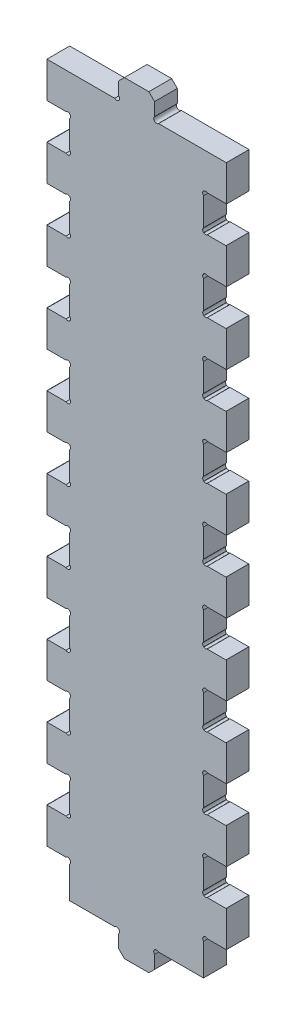
from build123d import *

# Parameters (mm, degrees)
BOSS_EXTRUDE1_DEPTH = 6.35
CHAMFER1_SIZE       = 1.5875
SKETCH1_W           = 6.31593513
SKETCH1_H           = 10.068268446
SKETCH1_W_2         = 6.289133039
SKETCH1_H_2         = 10.1524
CUT_EXTRUDE1_DEPTH  = 212.011770999
LPATTERN1_COUNT     = 9
LPATTERN1_PITCH     = 20
SKETCH3_W           = 2.992753623
SKETCH3_H           = 0.405797101
CUT_EXTRUDE3_DEPTH  = 2.54


# Read off the part's stored shape, not the designer's step: Boss-Extrude1
with BuildPart() as part:
    # Boss-Extrude1 outline → Boss-Extrude1 (new body)
    with BuildSketch(Plane.XY):
        with BuildLine():
            Line((-6.35, 190), (-1.066002504, 190))
            ThreePointArc((-1.066002504, 190), (0.02634773, 189.921017806), (0, 188.826132873))
            Line((0, 188.826132873), (0, 181.122532015))
            ThreePointArc((0, 181.122532015), (0, 180), (-1.122532015, 180))
            Line((-1.122532015, 180), (-6.35, 180))
            Line((-6.35, 180), (-6.35, 170))
            Line((-6.35, 170), (-1.122532015, 170))
            ThreePointArc((-1.122532015, 170), (0, 170), (0, 168.877467985))
            Line((0, 168.877467985), (0, 161.122532015))
            ThreePointArc((0, 161.122532015), (0, 160), (-1.122532015, 160))
            Line((-1.122532015, 160), (-6.35, 160))
            Line((-6.35, 160), (-6.35, 150))
            Line((-6.35, 150), (-1.122532015, 150))
            ThreePointArc((-1.122532015, 150), (0, 150), (0, 148.877467985))
            Line((0, 148.877467985), (0, 141.122532015))
            ThreePointArc((0, 141.122532015), (0, 140), (-1.122532015, 140))
            Line((-1.122532015, 140), (-6.35, 140))
            Line((-6.35, 140), (-6.35, 130))
            Line((-6.35, 130), (-1.122532015, 130))
            ThreePointArc((-1.122532015, 130), (0, 130), (0, 128.877467985))
            Line((0, 128.877467985), (0, 121.122532015))
            ThreePointArc((0, 121.122532015), (0, 120), (-1.122532015, 120))
            Line((-1.122532015, 120), (-6.35, 120))
            Line((-6.35, 120), (-6.35, 110))
            Line((-6.35, 110), (-1.122532015, 110))
            ThreePointArc((-1.122532015, 110), (0, 110), (0, 108.877467985))
            Line((0, 108.877467985), (0, 101.122532015))
            ThreePointArc((0, 101.122532015), (0, 100), (-1.122532015, 100))
            Line((-1.122532015, 100), (-6.35, 100))
            Line((-6.35, 100), (-6.35, 90))
            Line((-6.35, 90), (-1.122532015, 90))
            ThreePointArc((-1.122532015, 90), (0, 90), (0, 88.877467985))
            Line((0, 88.877467985), (0, 81.122532015))
            ThreePointArc((0, 81.122532015), (0, 80), (-1.122532015, 80))
            Line((-1.122532015, 80), (-6.35, 80))
            Line((-6.35, 80), (-6.35, 70))
            Line((-6.35, 70), (-1.122532015, 70))
            ThreePointArc((-1.122532015, 70), (0, 70), (0, 68.877467985))
            Line((0, 68.877467985), (0, 61.122532015))
            ThreePointArc((0, 61.122532015), (0, 60), (-1.122532015, 60))
            Line((-1.122532015, 60), (-6.35, 60))
            Line((-6.35, 60), (-6.35, 50))
            Line((-6.35, 50), (-1.122532015, 50))
            ThreePointArc((-1.122532015, 50), (0, 50), (0, 48.877467985))
            Line((0, 48.877467985), (0, 41.122532015))
            ThreePointArc((0, 41.122532015), (0, 40), (-1.122532015, 40))
            Line((-1.122532015, 40), (-6.35, 40))
            Line((-6.35, 40), (-6.35, 30))
            Line((-6.35, 30), (-1.122532015, 30))
            ThreePointArc((-1.122532015, 30), (0, 30), (0, 28.877467985))
            Line((0, 28.877467985), (0, 21.122532015))
            ThreePointArc((0, 21.122532015), (0, 20), (-1.122532015, 20))
            Line((-1.122532015, 20), (-6.35, 20))
            Line((-6.35, 20), (-6.35, 10))
            Line((-6.35, 10), (-1.122532015, 10))
            ThreePointArc((-1.122532015, 10), (0, 10), (0, 8.877467985))
            Line((0, 8.877467985), (0, 0))
            Line((0, 0), (12.527467985, 0))
            ThreePointArc((12.527467985, 0), (13.65, 0), (13.65, -1.122532015))
            Line((13.65, -1.122532015), (13.65, -6.35))
            Line((13.65, -6.35), (23.65, -6.35))
            Line((23.65, -6.35), (23.65, -1.122532015))
            ThreePointArc((23.65, -1.122532015), (23.65, 0), (24.772532015, 0))
            Line((24.772532015, 0), (37.3, 0))
            Line((37.3, 0), (37.3, 8.877467985))
            ThreePointArc((37.3, 8.877467985), (37.3, 10), (38.422532015, 10))
            Line((38.422532015, 10), (43.65, 10))
            Line((43.65, 10), (43.65, 20))
            Line((43.65, 20), (38.422532015, 20))
            ThreePointArc((38.422532015, 20), (37.3, 20), (37.3, 21.122532015))
            Line((37.3, 21.122532015), (37.3, 28.877467985))
            ThreePointArc((37.3, 28.877467985), (37.3, 30), (38.422532015, 30))
            Line((38.422532015, 30), (43.65, 30))
            Line((43.65, 30), (43.65, 40))
            Line((43.65, 40), (38.422532015, 40))
            ThreePointArc((38.422532015, 40), (37.3, 40), (37.3, 41.122532015))
            Line((37.3, 41.122532015), (37.3, 48.877467985))
            ThreePointArc((37.3, 48.877467985), (37.3, 50), (38.422532015, 50))
            Line((38.422532015, 50), (43.65, 50))
            Line((43.65, 50), (43.65, 60))
            Line((43.65, 60), (38.422532015, 60))
            ThreePointArc((38.422532015, 60), (37.3, 60), (37.3, 61.122532015))
            Line((37.3, 61.122532015), (37.3, 68.877467985))
            ThreePointArc((37.3, 68.877467985), (37.3, 70), (38.422532015, 70))
            Line((38.422532015, 70), (43.65, 70))
            Line((43.65, 70), (43.65, 80))
            Line((43.65, 80), (38.422532015, 80))
            ThreePointArc((38.422532015, 80), (37.3, 80), (37.3, 81.122532015))
            Line((37.3, 81.122532015), (37.3, 88.877467985))
            ThreePointArc((37.3, 88.877467985), (37.3, 90), (38.422532015, 90))
            Line((38.422532015, 90), (43.65, 90))
            Line((43.65, 90), (43.65, 100))
            Line((43.65, 100), (38.422532015, 100))
            ThreePointArc((38.422532015, 100), (37.3, 100), (37.3, 101.122532015))
            Line((37.3, 101.122532015), (37.3, 108.877467985))
            ThreePointArc((37.3, 108.877467985), (37.3, 110), (38.422532015, 110))
            Line((38.422532015, 110), (43.65, 110))
            Line((43.65, 110), (43.65, 120))
            Line((43.65, 120), (38.422532015, 120))
            ThreePointArc((38.422532015, 120), (37.3, 120), (37.3, 121.122532015))
            Line((37.3, 121.122532015), (37.3, 128.877467985))
            ThreePointArc((37.3, 128.877467985), (37.3, 130), (38.422532015, 130))
            Line((38.422532015, 130), (43.65, 130))
            Line((43.65, 130), (43.65, 140))
            Line((43.65, 140), (38.422532015, 140))
            ThreePointArc((38.422532015, 140), (37.3, 140), (37.3, 141.122532015))
            Line((37.3, 141.122532015), (37.3, 148.877467985))
            ThreePointArc((37.3, 148.877467985), (37.3, 150), (38.422532015, 150))
            Line((38.422532015, 150), (43.65, 150))
            Line((43.65, 150), (43.65, 160))
            Line((43.65, 160), (38.422532015, 160))
            ThreePointArc((38.422532015, 160), (37.3, 160), (37.3, 161.122532015))
            Line((37.3, 161.122532015), (37.3, 168.877467985))
            ThreePointArc((37.3, 168.877467985), (37.3, 170), (38.422532015, 170))
            Line((38.422532015, 170), (43.65, 170))
            Line((43.65, 170), (43.65, 180))
            Line((43.65, 180), (38.422532015, 180))
            ThreePointArc((38.422532015, 180), (37.3, 180), (37.3, 181.122532015))
            Line((37.3, 181.122532015), (37.3, 188.877467985))
            ThreePointArc((37.3, 188.877467985), (37.3, 190), (38.422532015, 190))
            Line((38.422532015, 190), (43.65, 190))
            Line((43.65, 190), (43.65, 200))
            Line((43.65, 200), (24.772532015, 200))
            ThreePointArc((24.772532015, 200), (23.65, 200), (23.65, 201.122532015))
            Line((23.65, 201.122532015), (23.65, 206.35))
            Line((23.65, 206.35), (13.65, 206.35))
            Line((13.65, 206.35), (13.65, 201.122532015))
            ThreePointArc((13.65, 201.122532015), (13.65, 200), (12.527467985, 200))
            Line((12.527467985, 200), (-6.35, 200))
            Line((-6.35, 200), (-6.35, 190))
        make_face()
    extrude(amount=BOSS_EXTRUDE1_DEPTH)

    # Chamfer1
    chamfer1_edges = [part.edges().sort_by_distance(p)[0] for p in [
        (13.65, 206.35, 3.175),
        (23.65, 206.35, 3.175),
        (23.65, -6.35, 3.175),
        (13.65, -6.35, 3.175),
    ]]
    chamfer(chamfer1_edges, length=CHAMFER1_SIZE)

    # Sketch1 → Cut-Extrude1 (cut, through all)
    with BuildSketch(Plane.XY.offset(6.35)):
        with Locations((-3.175002191, 184.974332444)):
            Rectangle(SKETCH1_W, SKETCH1_H)
        with Locations((40.474994567, 185)):
            Rectangle(SKETCH1_W_2, SKETCH1_H_2)
    cut_extrude1 = extrude(amount=-CUT_EXTRUDE1_DEPTH, mode=Mode.SUBTRACT)

    # LPattern1: Cut-Extrude1 ×9
    with Locations(*[(0, -i * LPATTERN1_PITCH, 0) for i in range(1, LPATTERN1_COUNT)]):
        add(cut_extrude1, mode=Mode.SUBTRACT)

    # Sketch3 → Cut-Extrude3 (cut)
    # profile 1 of 8: a face of its own
    with BuildSketch(Plane(origin=(0, 0, 0), x_dir=(-1, 0, 0), z_dir=(0, 0, -1))):
        with BuildLine():
            add(Edge.make_bspline(
                [(-31.669565217, 1.371449275), (-31.739195333, 1.347927689), (-31.878102831, 1.301003673), (-32.094061516, 1.254258906), (-32.314414682, 1.224655982), (-32.463362925, 1.221075114), (-32.538224638, 1.219275362)],
                knots=[0, 0, 0, 0, 0.994474773, 1.983911717, 2.986709619, 4, 4, 4, 4], degree=3))
            add(Edge.make_bspline(
                [(-32.538224638, 1.219275362), (-32.597461378, 1.220651993), (-32.712873714, 1.223334114), (-32.880657539, 1.243924608), (-33.037760981, 1.278845672), (-33.184646189, 1.327029017), (-33.321063485, 1.389662833), (-33.44631955, 1.467338836), (-33.561208509, 1.558024136), (-33.665039887, 1.662813822), (-33.757386997, 1.781315104), (-33.836435826, 1.914017245), (-33.904619253, 2.05928729), (-33.958155229, 2.218629134), (-34.002573318, 2.39033234), (-34.031435227, 2.575634592), (-34.050187662, 2.773914739), (-34.052453103, 2.910578207), (-34.053623188, 2.981163949)],
                knots=[0, 0, 0, 0, 1.072370344, 2.089324368, 3.054894172, 3.982167072, 4.883220536, 5.766007853, 6.644560033, 7.52738623, 8.430658994, 9.357672753, 10.318538922, 11.330575956, 12.396783324, 13.526066154, 14.722230158, 16, 16, 16, 16], degree=3))
            add(Edge.make_bspline(
                [(-34.053623188, 2.981163949), (-34.052146608, 3.049894194), (-34.049255307, 3.184475335), (-34.029807187, 3.381226133), (-33.995207247, 3.56759635), (-33.949398299, 3.743773361), (-33.888708922, 3.907882056), (-33.817665032, 4.0603251), (-33.7342573, 4.199499651), (-33.63966111, 4.325672029), (-33.533369297, 4.438144093), (-33.416752828, 4.537759358), (-33.288803984, 4.622896086), (-33.151359522, 4.694576142), (-33.003836974, 4.751221896), (-32.847411307, 4.790992406), (-32.682528536, 4.816729312), (-32.569762619, 4.819372394), (-32.512069746, 4.820724638)],
                knots=[0, 0, 0, 0, 1.219579151, 2.388065895, 3.50339749, 4.580233523, 5.613961845, 6.603771101, 7.560489467, 8.487754287, 9.396405489, 10.300984393, 11.203313264, 12.1174982, 13.046432371, 14.000390303, 14.976967236, 16, 16, 16, 16], degree=3))
            add(Edge.make_bspline(
                [(-32.512069746, 4.820724638), (-32.472691142, 4.820309343), (-32.395188832, 4.819491989), (-32.281277856, 4.811830577), (-32.171631973, 4.801507882), (-32.03228403, 4.77870042), (-31.863035382, 4.740545133), (-31.733837361, 4.692467772), (-31.669565217, 4.668550725)],
                knots=[0, 0, 0, 0, 0.82263702, 1.61905864, 2.384719601, 3.122514214, 4.568537041, 6, 6, 6, 6], degree=3))
            Line((-31.669565217, 4.668550725), (-31.669565217, 4.212028986))
            add(Edge.make_bspline(
                [(-31.669565217, 4.212028986), (-31.700818043, 4.228006992), (-31.762750675, 4.259670049), (-31.858927014, 4.300256406), (-31.956563093, 4.334988724), (-32.056642321, 4.363716119), (-32.15924419, 4.38692655), (-32.266166522, 4.40374771), (-32.377690026, 4.413104658), (-32.453666685, 4.414313541), (-32.492255435, 4.414927536)],
                knots=[0, 0, 0, 0, 0.983614603, 1.949194672, 2.923566415, 3.886871985, 4.866016098, 5.870457402, 6.918399582, 8, 8, 8, 8], degree=3))
            add(Edge.make_bspline(
                [(-32.492255435, 4.414927536), (-32.53170594, 4.414079098), (-32.608940542, 4.412418059), (-32.72173213, 4.392935509), (-32.829173737, 4.364356351), (-32.930335592, 4.322530852), (-33.025212266, 4.270502436), (-33.112065741, 4.205955487), (-33.192562939, 4.132297811), (-33.264988403, 4.047542217), (-33.329231223, 3.952734893), (-33.385538918, 3.847928391), (-33.435033831, 3.733595378), (-33.474634002, 3.608856667), (-33.507644287, 3.475288013), (-33.530095036, 3.3323738), (-33.543649929, 3.180363856), (-33.545450622, 3.076037954), (-33.546376812, 3.022377717)],
                knots=[0, 0, 0, 0, 0.961408976, 1.882207611, 2.784411545, 3.668921893, 4.545980223, 5.417431557, 6.302341026, 7.202770486, 8.13058038, 9.09095177, 10.101446619, 11.165409356, 12.279999165, 13.455113719, 14.691032636, 16, 16, 16, 16], degree=3))
            add(Edge.make_bspline(
                [(-33.546376812, 3.022377717), (-33.545723125, 2.966344917), (-33.544457099, 2.857823606), (-33.531687922, 2.700300155), (-33.510331954, 2.553410374), (-33.481592801, 2.416771879), (-33.443561706, 2.290738296), (-33.396906293, 2.175558302), (-33.342149559, 2.07061959), (-33.278590361, 1.976776906), (-33.206998732, 1.893174316), (-33.126079069, 1.821964093), (-33.038602635, 1.759558623), (-32.941622641, 1.711121664), (-32.838070087, 1.671337078), (-32.726027286, 1.645283692), (-32.606664741, 1.627932746), (-32.524288663, 1.626043454), (-32.481951993, 1.625072464)],
                knots=[0, 0, 0, 0, 1.34450783, 2.603970389, 3.789343747, 4.904814261, 5.951782154, 6.944310538, 7.883053746, 8.786934864, 9.658944679, 10.516661903, 11.367981323, 12.229999549, 13.110838734, 14.024275634, 14.984588823, 16, 16, 16, 16], degree=3))
            add(Edge.make_bspline(
                [(-32.481951993, 1.625072464), (-32.44546661, 1.625597048), (-32.373138953, 1.62663697), (-32.265962825, 1.637522956), (-32.161109069, 1.653958868), (-32.024587415, 1.684880566), (-31.858072178, 1.737895316), (-31.732355894, 1.797967273), (-31.669565217, 1.827971014)],
                knots=[0, 0, 0, 0, 0.776705674, 1.539720753, 2.291683871, 3.035542813, 4.519362263, 6, 6, 6, 6], degree=3))
            Line((-31.669565217, 1.827971014), (-31.669565217, 1.371449275))
        make_face()
    # profile 2 of 8: a face of its own
    with BuildSketch(Plane(origin=(0, 0, 0), x_dir=(-1, 0, 0), z_dir=(0, 0, -1))):
        with BuildLine():
            add(Edge.make_bspline(
                [(-28.473913043, 3.042984601), (-28.475228447, 2.966845569), (-28.477768509, 2.819820029), (-28.498691345, 2.60738994), (-28.531869502, 2.410756522), (-28.58027643, 2.230228254), (-28.641039128, 2.065841825), (-28.709614146, 1.915433039), (-28.788950258, 1.780200367), (-28.877820501, 1.659642575), (-28.976030807, 1.554801835), (-29.081000327, 1.462639641), (-29.196205585, 1.387760737), (-29.31749743, 1.325488378), (-29.444853826, 1.278198208), (-29.575949064, 1.243802001), (-29.710765698, 1.223740262), (-29.801671738, 1.220770552), (-29.847441123, 1.219275362)],
                knots=[0, 0, 0, 0, 1.423082774, 2.747992794, 3.986236128, 5.147128242, 6.236197569, 7.259302453, 8.233395673, 9.161912359, 10.053001658, 10.914402565, 11.766421957, 12.614596425, 13.458547256, 14.300675266, 15.144423756, 16, 16, 16, 16], degree=3))
            add(Edge.make_bspline(
                [(-29.847441123, 1.219275362), (-29.901424707, 1.220748877), (-30.006208407, 1.223609012), (-30.157998749, 1.247107372), (-30.299147587, 1.284739236), (-30.429785903, 1.33814703), (-30.548892308, 1.406847955), (-30.658231986, 1.488313215), (-30.756067663, 1.584380358), (-30.843558352, 1.693479173), (-30.920021031, 1.81601454), (-30.985425388, 1.951217929), (-31.041029109, 2.098721403), (-31.085818589, 2.258431097), (-31.120414745, 2.429607172), (-31.144383481, 2.611545929), (-31.159998336, 2.803618457), (-31.161532676, 2.935162748), (-31.162318841, 3.002563406)],
                knots=[0, 0, 0, 0, 1.030115455, 1.999483942, 2.924432069, 3.813267415, 4.685316872, 5.542716903, 6.40939724, 7.295524004, 8.206506083, 9.160640047, 10.158252241, 11.211975818, 12.323750963, 13.4892538, 14.713543989, 16, 16, 16, 16], degree=3))
            add(Edge.make_bspline(
                [(-31.162318841, 3.002563406), (-31.160896447, 3.077899952), (-31.158146266, 3.223562242), (-31.138583131, 3.434517882), (-31.104931941, 3.629935553), (-31.057372036, 3.809929), (-30.997799031, 3.974363234), (-30.928734876, 4.124261547), (-30.8508524, 4.25996585), (-30.761250926, 4.3795857), (-30.663177066, 4.484740581), (-30.558096251, 4.576639822), (-30.443922204, 4.652475143), (-30.323287376, 4.714661318), (-30.196353547, 4.761635893), (-30.065598845, 4.796318613), (-29.931008715, 4.816238608), (-29.840106319, 4.819222372), (-29.794338768, 4.820724638)],
                knots=[0, 0, 0, 0, 1.41309666, 2.732205102, 3.969807196, 5.128608405, 6.219709524, 7.24631839, 8.221244419, 9.148965463, 10.043106611, 10.914447659, 11.761129373, 12.607796584, 13.454637821, 14.294855332, 15.141493535, 16, 16, 16, 16], degree=3))
            add(Edge.make_bspline(
                [(-29.794338768, 4.820724638), (-29.740364217, 4.819205794), (-29.635336796, 4.816250322), (-29.483350255, 4.793314891), (-29.342341779, 4.754302026), (-29.212179065, 4.700137448), (-29.092477706, 4.631499895), (-28.983369883, 4.549457627), (-28.884588873, 4.454102795), (-28.797712351, 4.344814066), (-28.720310859, 4.223092958), (-28.652807456, 4.089223539), (-28.59787567, 3.94189839), (-28.551864665, 3.78323559), (-28.516761185, 3.613040237), (-28.49153954, 3.432233125), (-28.476310925, 3.241127673), (-28.474725472, 3.110117664), (-28.473913043, 3.042984601)],
                knots=[0, 0, 0, 0, 1.031800753, 2.007749398, 2.930678117, 3.822900438, 4.696376593, 5.562252438, 6.426830471, 7.314406963, 8.225311853, 9.18096675, 10.175487812, 11.227471919, 12.337140194, 13.495232744, 14.716489688, 16, 16, 16, 16], degree=3))
        make_face()
        with BuildLine():
            add(Edge.make_bspline(
                [(-28.98115942, 3.008903986), (-28.981926533, 3.059632923), (-28.983429722, 3.159038275), (-28.990533411, 3.304869863), (-29.00641256, 3.443823063), (-29.025438421, 3.575988389), (-29.05118557, 3.700613221), (-29.084697001, 3.816507216), (-29.123633609, 3.924148555), (-29.171405434, 4.022056517), (-29.226090432, 4.110228152), (-29.287252674, 4.189423441), (-29.357349177, 4.256635198), (-29.434252079, 4.31396847), (-29.518946842, 4.359667179), (-29.6121679, 4.392455719), (-29.713776225, 4.411515246), (-29.784217551, 4.413767608), (-29.820493659, 4.414927536)],
                knots=[0, 0, 0, 0, 1.323673599, 2.593790554, 3.807090586, 4.970987518, 6.076778004, 7.123914636, 8.116191169, 9.059475772, 9.960330598, 10.819370074, 11.662669578, 12.485668992, 13.315223066, 14.163241623, 15.054100047, 16, 16, 16, 16], degree=3))
            add(Edge.make_bspline(
                [(-29.820493659, 4.414927536), (-29.855710842, 4.413461751), (-29.924346334, 4.410605053), (-30.023927459, 4.391125777), (-30.115110247, 4.355548722), (-30.198466369, 4.307316432), (-30.274088053, 4.247558746), (-30.341549251, 4.176452065), (-30.403836351, 4.097424967), (-30.457817214, 4.007728909), (-30.503613603, 3.909137643), (-30.54591447, 3.803176701), (-30.578734751, 3.688170111), (-30.607775025, 3.566407128), (-30.62856039, 3.438398216), (-30.643297926, 3.306117388), (-30.653389461, 3.169950555), (-30.654505458, 3.077876258), (-30.655072464, 3.031096014)],
                knots=[0, 0, 0, 0, 0.938104053, 1.828290259, 2.688226573, 3.533173995, 4.38495139, 5.245952462, 6.138444459, 7.060521377, 8.026891732, 9.031849607, 10.096184638, 11.209149641, 12.36492099, 13.547735175, 14.754076334, 16, 16, 16, 16], degree=3))
            add(Edge.make_bspline(
                [(-30.655072464, 3.031096014), (-30.654449258, 2.979828752), (-30.653234042, 2.879860407), (-30.644176454, 2.733124897), (-30.630496216, 2.593393901), (-30.609919061, 2.460814719), (-30.583396469, 2.336556572), (-30.550078425, 2.221052236), (-30.510641972, 2.114287784), (-30.464308956, 2.016509345), (-30.409917181, 1.928699423), (-30.349292722, 1.849969745), (-30.279157788, 1.78352854), (-30.204110145, 1.72499193), (-30.11921056, 1.680375974), (-30.026952634, 1.647741059), (-29.92617417, 1.62840114), (-29.856509354, 1.626206869), (-29.820493659, 1.625072464)],
                knots=[0, 0, 0, 0, 1.340540585, 2.613980496, 3.843097936, 5.010722051, 6.120504555, 7.163418743, 8.151508278, 9.093960035, 9.987380757, 10.848401497, 11.683877306, 12.507385072, 13.329500698, 14.179475102, 15.05881515, 16, 16, 16, 16], degree=3))
            add(Edge.make_bspline(
                [(-29.820493659, 1.625072464), (-29.785245128, 1.626400933), (-29.716754028, 1.628982269), (-29.617896974, 1.650252809), (-29.526318043, 1.684356466), (-29.442558052, 1.732724667), (-29.366167488, 1.792430013), (-29.297821632, 1.863274866), (-29.235601592, 1.942784284), (-29.180978268, 2.032425908), (-29.132976638, 2.130425457), (-29.091684681, 2.236825819), (-29.056869344, 2.350719034), (-29.029787261, 2.472495751), (-29.00729818, 2.599899639), (-28.99299489, 2.732578643), (-28.982822061, 2.869253151), (-28.981719534, 2.961858103), (-28.98115942, 3.008903986)],
                knots=[0, 0, 0, 0, 0.936906737, 1.820494917, 2.676828052, 3.526792157, 4.383009914, 5.247809723, 6.13916262, 7.06372975, 8.034989121, 9.038664354, 10.096936984, 11.200050273, 12.355522744, 13.536827286, 14.74863997, 16, 16, 16, 16], degree=3))
        make_face(mode=Mode.SUBTRACT)
    # profile 3 of 8: a face of its own
    with BuildSketch(Plane(origin=(0, 0, 0), x_dir=(-1, 0, 0), z_dir=(0, 0, -1))):
        with BuildLine():
            Line((-25.531884058, 1.27), (-26.069248188, 1.27))
            Line((-26.069248188, 1.27), (-26.572531703, 2.362957428))
            add(Edge.make_bspline(
                [(-26.572531703, 2.362957428), (-26.59071745, 2.401706773), (-26.624454269, 2.473591622), (-26.683855152, 2.567982497), (-26.745377969, 2.644032892), (-26.812021148, 2.702499767), (-26.884726718, 2.745154031), (-26.963955282, 2.772750588), (-27.050856191, 2.788792395), (-27.111407774, 2.790724962), (-27.143183877, 2.79173913)],
                knots=[0, 0, 0, 0, 1.339134837, 2.484261414, 3.482991323, 4.391871607, 5.244507385, 6.105289549, 7.005698766, 8, 8, 8, 8], degree=3))
            Line((-27.143183877, 2.79173913), (-27.357971014, 2.79173913))
            Line((-27.357971014, 2.79173913), (-27.357971014, 1.27))
            Line((-27.357971014, 1.27), (-27.865217391, 1.27))
            Line((-27.865217391, 1.27), (-27.865217391, 4.77))
            Line((-27.865217391, 4.77), (-26.934737319, 4.77))
            add(Edge.make_bspline(
                [(-26.934737319, 4.77), (-26.88583097, 4.769366361), (-26.791538416, 4.768144689), (-26.65538895, 4.755266173), (-26.5298858, 4.734490516), (-26.415222463, 4.704095291), (-26.310621888, 4.666954567), (-26.215725616, 4.622570659), (-26.130520694, 4.571200811), (-26.05533264, 4.51258738), (-25.988863898, 4.44862251), (-25.9330839, 4.376973978), (-25.885783361, 4.299801302), (-25.848661682, 4.215927791), (-25.820514838, 4.127009504), (-25.7995048, 4.033467957), (-25.787775054, 3.935195092), (-25.786271456, 3.868082264), (-25.785507246, 3.83397192)],
                knots=[0, 0, 0, 0, 1.390037284, 2.680023546, 3.883960013, 5.002565466, 6.047913656, 7.03574216, 7.976084698, 8.870016629, 9.741095147, 10.591561451, 11.444313202, 12.308368875, 13.191986167, 14.092206828, 15.030357037, 16, 16, 16, 16], degree=3))
            add(Edge.make_bspline(
                [(-25.785507246, 3.83397192), (-25.78614064, 3.806470167), (-25.787386286, 3.752384571), (-25.796541935, 3.672416754), (-25.810405144, 3.594646937), (-25.831177465, 3.51943529), (-25.857372341, 3.447074993), (-25.889008124, 3.377623321), (-25.92739873, 3.311847098), (-25.970855036, 3.249061153), (-26.020300638, 3.190279445), (-26.074908756, 3.135303891), (-26.135985286, 3.085425286), (-26.201171245, 3.038559939), (-26.27224957, 2.997093549), (-26.348501973, 2.961662975), (-26.429540429, 2.931184091), (-26.485997266, 2.915973394), (-26.514673913, 2.908247283)],
                knots=[0, 0, 0, 0, 1.032708305, 2.030948508, 3.019625047, 3.996933367, 4.957424013, 5.907556856, 6.85893238, 7.814077788, 8.77200233, 9.740252168, 10.719774328, 11.730219428, 12.753012585, 13.805036997, 14.885091985, 16, 16, 16, 16], degree=3))
            add(Edge.make_bspline(
                [(-26.514673913, 2.908247283), (-26.491365725, 2.899698355), (-26.445120721, 2.88273671), (-26.381537422, 2.844964981), (-26.321734957, 2.801060751), (-26.26943634, 2.744951285), (-26.218302198, 2.681752522), (-26.167615772, 2.608930821), (-26.116144477, 2.526752178), (-26.083731693, 2.467493302), (-26.066870471, 2.436666667)],
                knots=[0, 0, 0, 0, 0.890820497, 1.767447404, 2.649001527, 3.549193506, 4.515009134, 5.571837998, 6.736863216, 8, 8, 8, 8], degree=3))
            Line((-26.066870471, 2.436666667), (-25.531884058, 1.27))
        make_face()
        with BuildLine():
            add(Edge.make_bspline(
                [(-26.292753623, 3.799891304), (-26.293124706, 3.822898772), (-26.293843697, 3.867476789), (-26.301801751, 3.932004947), (-26.315419329, 3.991916103), (-26.333559167, 4.04743245), (-26.356222969, 4.099077043), (-26.386280569, 4.145069931), (-26.420207314, 4.187386547), (-26.459395879, 4.224918851), (-26.503530008, 4.257569148), (-26.552021493, 4.285946413), (-26.604420772, 4.310685313), (-26.661240636, 4.330650541), (-26.722407824, 4.345246859), (-26.787751823, 4.356626993), (-26.857479949, 4.36267721), (-26.905401996, 4.363685654), (-26.929981884, 4.364202899)],
                knots=[0, 0, 0, 0, 1.136086502, 2.201219443, 3.204852043, 4.166451082, 5.083443327, 5.98129036, 6.87199526, 7.758098985, 8.653381414, 9.577773354, 10.529401831, 11.511765708, 12.546811162, 13.632454437, 14.78565276, 16, 16, 16, 16], degree=3))
            Line((-26.929981884, 4.364202899), (-27.357971014, 4.364202899))
            Line((-27.357971014, 4.364202899), (-27.357971014, 3.197536232))
            Line((-27.357971014, 3.197536232), (-26.991009964, 3.197536232))
            add(Edge.make_bspline(
                [(-26.991009964, 3.197536232), (-26.964844251, 3.198003869), (-26.913732163, 3.198917352), (-26.839172344, 3.205692333), (-26.768930469, 3.219058388), (-26.702309597, 3.234864927), (-26.640278984, 3.257282772), (-26.583156087, 3.284404318), (-26.529979634, 3.315111584), (-26.482655767, 3.351980881), (-26.439266493, 3.392522944), (-26.401291739, 3.437783842), (-26.368256734, 3.487355499), (-26.341585497, 3.54191407), (-26.318809147, 3.600238954), (-26.304474303, 3.663570044), (-26.294372393, 3.73034894), (-26.293301905, 3.776337111), (-26.292753623, 3.799891304)],
                knots=[0, 0, 0, 0, 1.202615583, 2.349188572, 3.435207305, 4.486530095, 5.492783739, 6.45958443, 7.390413995, 8.308405015, 9.210274755, 10.115082188, 11.017605575, 11.940721498, 12.901403136, 13.887978084, 14.918265918, 16, 16, 16, 16], degree=3))
        make_face(mode=Mode.SUBTRACT)
    # profile 4 of 8: a face of its own
    with BuildSketch(Plane(origin=(0, 0, 0), x_dir=(-1, 0, 0), z_dir=(0, 0, -1))):
        with Locations((-23.832608695, 0.356956522)):
            Rectangle(SKETCH3_W, SKETCH3_H)
    # profile 5 of 8: a face of its own
    with BuildSketch(Plane(origin=(0, 0, 0), x_dir=(-1, 0, 0), z_dir=(0, 0, -1))):
        Polygon((-19.36884058, 1.27), (-19.887975543, 1.27), (-20.122576993, 2.030869565), (-21.576154891, 2.030869565), (-21.816304348, 1.27), (-22.310869565, 1.27), (-21.147373188, 4.77), (-20.495086051, 4.77), align=None)
        Polygon((-20.24701087, 2.436666667), (-20.839855072, 4.361825181), (-21.447758152, 2.436666667), align=None, mode=Mode.SUBTRACT)
    # profile 6 of 8: a face of its own
    with BuildSketch(Plane(origin=(0, 0, 0), x_dir=(-1, 0, 0), z_dir=(0, 0, -1))):
        with BuildLine():
            add(Edge.make_bspline(
                [(-16.604347826, 4.212028986), (-16.671685972, 4.241978827), (-16.805959438, 4.301699345), (-16.982405243, 4.355300698), (-17.127599713, 4.38625715), (-17.241447637, 4.402665486), (-17.359991297, 4.41338069), (-17.440752016, 4.414406896), (-17.481725543, 4.414927536)],
                knots=[0, 0, 0, 0, 1.45945927, 2.910187841, 3.643322816, 4.400006487, 5.188251666, 6, 6, 6, 6], degree=3))
            add(Edge.make_bspline(
                [(-17.481725543, 4.414927536), (-17.528298795, 4.413803129), (-17.619210037, 4.411608279), (-17.75135933, 4.391793954), (-17.876129285, 4.361676224), (-17.992021277, 4.316724129), (-18.09961569, 4.261098619), (-18.198896949, 4.194764861), (-18.289289582, 4.117851723), (-18.370515015, 4.030617041), (-18.443449878, 3.934303764), (-18.505371027, 3.827187075), (-18.56081546, 3.712025168), (-18.605304205, 3.587287873), (-18.641533062, 3.454928879), (-18.66482618, 3.314920992), (-18.682025106, 3.168635229), (-18.683370849, 3.068665689), (-18.684057971, 3.017622283)],
                knots=[0, 0, 0, 0, 1.073569988, 2.0956145, 3.075462191, 4.028316933, 4.954955511, 5.864200373, 6.776299374, 7.685952519, 8.608514939, 9.556388192, 10.53488969, 11.552674678, 12.606592505, 13.695564134, 14.823379042, 16, 16, 16, 16], degree=3))
            add(Edge.make_bspline(
                [(-18.684057971, 3.017622283), (-18.683323419, 2.964499795), (-18.68189621, 2.861284738), (-18.670071614, 2.710352608), (-18.649283947, 2.568326192), (-18.622339638, 2.434202904), (-18.585165854, 2.309794763), (-18.539127761, 2.194836244), (-18.484377094, 2.089383365), (-18.420327872, 1.993691992), (-18.345825947, 1.908903883), (-18.261980886, 1.834558254), (-18.168402358, 1.770918287), (-18.065514933, 1.717080335), (-17.951783693, 1.676294944), (-17.828369934, 1.645917399), (-17.694080748, 1.628834156), (-17.601187031, 1.626356292), (-17.553057065, 1.625072464)],
                knots=[0, 0, 0, 0, 1.243148344, 2.415391902, 3.539864978, 4.600895424, 5.61417527, 6.574020235, 7.494941044, 8.390096718, 9.261974012, 10.129213218, 11.00555139, 11.904308457, 12.839297802, 13.826028221, 14.87362472, 16, 16, 16, 16], degree=3))
            add(Edge.make_bspline(
                [(-17.553057065, 1.625072464), (-17.535349737, 1.625452788), (-17.498576303, 1.626242621), (-17.442008191, 1.630414017), (-17.383541095, 1.63643611), (-17.324691356, 1.645563979), (-17.266659077, 1.655350484), (-17.2107909, 1.667869364), (-17.159235101, 1.682611824), (-17.126866371, 1.694136649), (-17.111594203, 1.699574275)],
                knots=[0, 0, 0, 0, 0.945101657, 1.962726016, 3.026203458, 4.081046807, 5.14040368, 6.166587829, 7.134962126, 8, 8, 8, 8], degree=3))
            Line((-17.111594203, 1.699574275), (-17.111594203, 2.842463768))
            Line((-17.111594203, 2.842463768), (-17.815398551, 2.842463768))
            Line((-17.815398551, 2.842463768), (-17.815398551, 3.24826087))
            Line((-17.815398551, 3.24826087), (-16.604347826, 3.24826087))
            Line((-16.604347826, 3.24826087), (-16.604347826, 1.4340625))
            add(Edge.make_bspline(
                [(-16.604347826, 1.4340625), (-16.642462287, 1.417209541), (-16.71987218, 1.382981437), (-16.840983295, 1.339920196), (-16.966485916, 1.302995057), (-17.094710705, 1.271941469), (-17.224135724, 1.248286463), (-17.352760672, 1.232094738), (-17.478624927, 1.220982207), (-17.561488587, 1.219837645), (-17.602196558, 1.219275362)],
                knots=[0, 0, 0, 0, 0.972427008, 1.974984516, 2.997371287, 4.024859125, 5.052920405, 6.066341974, 7.050062525, 8, 8, 8, 8], degree=3))
            add(Edge.make_bspline(
                [(-17.602196558, 1.219275362), (-17.661975873, 1.220549453), (-17.778763946, 1.223038584), (-17.94923578, 1.245274874), (-18.110765005, 1.279480568), (-18.263031407, 1.328767242), (-18.404923992, 1.392014428), (-18.536623592, 1.468920694), (-18.657385066, 1.559274622), (-18.7667799, 1.663851987), (-18.863790502, 1.782357507), (-18.950280536, 1.913681128), (-19.022326272, 2.059870624), (-19.085034876, 2.218255203), (-19.132922282, 2.390689086), (-19.166396565, 2.576156273), (-19.187383459, 2.7743509), (-19.189971003, 2.910834715), (-19.191304348, 2.981163949)],
                knots=[0, 0, 0, 0, 1.063600106, 2.077906186, 3.054673402, 3.998980003, 4.920963561, 5.814580945, 6.708049843, 7.599412522, 8.501355178, 9.428695674, 10.391875437, 11.396983258, 12.456970005, 13.571147305, 14.748427771, 16, 16, 16, 16], degree=3))
            add(Edge.make_bspline(
                [(-19.191304348, 2.981163949), (-19.189762683, 3.051234262), (-19.186746358, 3.188329538), (-19.163823686, 3.388107727), (-19.124808375, 3.57663748), (-19.071261525, 3.753466999), (-19.003050694, 3.918384709), (-18.921067339, 4.069812268), (-18.828140444, 4.209490294), (-18.721401271, 4.33489742), (-18.603038521, 4.447268475), (-18.472740354, 4.545145369), (-18.332040068, 4.629863312), (-18.179633944, 4.698617982), (-18.017925789, 4.753121167), (-17.847399274, 4.793142199), (-17.668607738, 4.816052266), (-17.546780694, 4.819150711), (-17.484895833, 4.820724638)],
                knots=[0, 0, 0, 0, 1.187604435, 2.323594002, 3.403022287, 4.447090083, 5.450927467, 6.422737292, 7.361747858, 8.289531684, 9.208213513, 10.122694231, 11.046633145, 11.986550994, 12.950975564, 13.935151001, 14.951112262, 16, 16, 16, 16], degree=3))
            add(Edge.make_bspline(
                [(-17.484895833, 4.820724638), (-17.406074354, 4.819304178), (-17.251879959, 4.816525405), (-17.062144607, 4.791949095), (-16.915975949, 4.764804237), (-16.80965161, 4.738450996), (-16.705530118, 4.707063325), (-16.638024656, 4.681368998), (-16.604347826, 4.668550725)],
                knots=[0, 0, 0, 0, 1.577605647, 3.086188538, 3.823906723, 4.553997738, 5.27862473, 6, 6, 6, 6], degree=3))
            Line((-16.604347826, 4.668550725), (-16.604347826, 4.212028986))
        make_face()
    # profile 7 of 8: a face of its own
    with BuildSketch(Plane(origin=(0, 0, 0), x_dir=(-1, 0, 0), z_dir=(0, 0, -1))):
        Polygon((-13.383333333, 1.27), (-13.902468297, 1.27), (-14.137069746, 2.030869565), (-15.590647645, 2.030869565), (-15.830797101, 1.27), (-16.325362319, 1.27), (-15.161865942, 4.77), (-14.509578804, 4.77), align=None)
        Polygon((-14.261503623, 2.436666667), (-14.854347826, 4.361825181), (-15.462250906, 2.436666667), align=None, mode=Mode.SUBTRACT)
    # profile 8 of 8: a face of its own
    with BuildSketch(Plane(origin=(0, 0, 0), x_dir=(-1, 0, 0), z_dir=(0, 0, -1))):
        with BuildLine():
            Line((-10.568115942, 1.27), (-11.105480072, 1.27))
            Line((-11.105480072, 1.27), (-11.608763587, 2.362957428))
            add(Edge.make_bspline(
                [(-11.608763587, 2.362957428), (-11.626949334, 2.401706773), (-11.660686153, 2.473591622), (-11.720087036, 2.567982497), (-11.781609853, 2.644032892), (-11.848253032, 2.702499767), (-11.920958602, 2.745154031), (-12.000187166, 2.772750588), (-12.087088075, 2.788792395), (-12.147639658, 2.790724962), (-12.179415761, 2.79173913)],
                knots=[0, 0, 0, 0, 1.339134837, 2.484261414, 3.482991323, 4.391871607, 5.244507385, 6.105289549, 7.005698766, 8, 8, 8, 8], degree=3))
            Line((-12.179415761, 2.79173913), (-12.394202899, 2.79173913))
            Line((-12.394202899, 2.79173913), (-12.394202899, 1.27))
            Line((-12.394202899, 1.27), (-12.901449275, 1.27))
            Line((-12.901449275, 1.27), (-12.901449275, 4.77))
            Line((-12.901449275, 4.77), (-11.970969203, 4.77))
            add(Edge.make_bspline(
                [(-11.970969203, 4.77), (-11.922062854, 4.769366361), (-11.8277703, 4.768144689), (-11.691620835, 4.755266173), (-11.566117684, 4.734490516), (-11.451454347, 4.704095291), (-11.346853773, 4.666954567), (-11.2519575, 4.622570659), (-11.166752578, 4.571200811), (-11.091564525, 4.51258738), (-11.025095783, 4.44862251), (-10.969315784, 4.376973978), (-10.922015245, 4.299801302), (-10.884893566, 4.215927791), (-10.856746722, 4.127009504), (-10.835736684, 4.033467957), (-10.824006938, 3.935195092), (-10.82250334, 3.868082264), (-10.82173913, 3.83397192)],
                knots=[0, 0, 0, 0, 1.390037284, 2.680023546, 3.883960013, 5.002565466, 6.047913656, 7.03574216, 7.976084698, 8.870016629, 9.741095147, 10.591561451, 11.444313202, 12.308368875, 13.191986167, 14.092206828, 15.030357037, 16, 16, 16, 16], degree=3))
            add(Edge.make_bspline(
                [(-10.82173913, 3.83397192), (-10.822372524, 3.806470167), (-10.82361817, 3.752384571), (-10.83277382, 3.672416754), (-10.846637028, 3.594646937), (-10.867409349, 3.51943529), (-10.893604226, 3.447074993), (-10.925240008, 3.377623321), (-10.963630614, 3.311847098), (-11.00708692, 3.249061153), (-11.056532522, 3.190279445), (-11.11114064, 3.135303891), (-11.17221717, 3.085425286), (-11.237403129, 3.038559939), (-11.308481454, 2.997093549), (-11.384733857, 2.961662975), (-11.465772313, 2.931184091), (-11.52222915, 2.915973394), (-11.550905797, 2.908247283)],
                knots=[0, 0, 0, 0, 1.032708305, 2.030948508, 3.019625047, 3.996933367, 4.957424013, 5.907556856, 6.85893238, 7.814077788, 8.77200233, 9.740252168, 10.719774328, 11.730219428, 12.753012585, 13.805036997, 14.885091985, 16, 16, 16, 16], degree=3))
            add(Edge.make_bspline(
                [(-11.550905797, 2.908247283), (-11.527597609, 2.899698355), (-11.481352605, 2.88273671), (-11.417769306, 2.844964981), (-11.357966841, 2.801060751), (-11.305668225, 2.744951285), (-11.254534082, 2.681752522), (-11.203847656, 2.608930821), (-11.152376361, 2.526752178), (-11.119963577, 2.467493302), (-11.103102355, 2.436666667)],
                knots=[0, 0, 0, 0, 0.890820497, 1.767447404, 2.649001527, 3.549193506, 4.515009134, 5.571837998, 6.736863216, 8, 8, 8, 8], degree=3))
            Line((-11.103102355, 2.436666667), (-10.568115942, 1.27))
        make_face()
        with BuildLine():
            add(Edge.make_bspline(
                [(-11.328985507, 3.799891304), (-11.329356591, 3.822898772), (-11.330075581, 3.867476789), (-11.338033636, 3.932004947), (-11.351651213, 3.991916103), (-11.369791051, 4.04743245), (-11.392454853, 4.099077043), (-11.422512453, 4.145069931), (-11.456439198, 4.187386547), (-11.495627763, 4.224918851), (-11.539761892, 4.257569148), (-11.588253377, 4.285946413), (-11.640652656, 4.310685313), (-11.69747252, 4.330650541), (-11.758639708, 4.345246859), (-11.823983707, 4.356626993), (-11.893711834, 4.36267721), (-11.94163388, 4.363685654), (-11.966213768, 4.364202899)],
                knots=[0, 0, 0, 0, 1.136086502, 2.201219443, 3.204852043, 4.166451082, 5.083443327, 5.98129036, 6.87199526, 7.758098985, 8.653381414, 9.577773354, 10.529401831, 11.511765708, 12.546811162, 13.632454437, 14.78565276, 16, 16, 16, 16], degree=3))
            Line((-11.966213768, 4.364202899), (-12.394202899, 4.364202899))
            Line((-12.394202899, 4.364202899), (-12.394202899, 3.197536232))
            Line((-12.394202899, 3.197536232), (-12.027241848, 3.197536232))
            add(Edge.make_bspline(
                [(-12.027241848, 3.197536232), (-12.001076135, 3.198003869), (-11.949964047, 3.198917352), (-11.875404228, 3.205692333), (-11.805162354, 3.219058388), (-11.738541481, 3.234864927), (-11.676510868, 3.257282772), (-11.619387971, 3.284404318), (-11.566211518, 3.315111584), (-11.518887651, 3.351980881), (-11.475498377, 3.392522944), (-11.437523623, 3.437783842), (-11.404488618, 3.487355499), (-11.377817381, 3.54191407), (-11.355041031, 3.600238954), (-11.340706187, 3.663570044), (-11.330604277, 3.73034894), (-11.329533789, 3.776337111), (-11.328985507, 3.799891304)],
                knots=[0, 0, 0, 0, 1.202615583, 2.349188572, 3.435207305, 4.486530095, 5.492783739, 6.45958443, 7.390413995, 8.308405015, 9.210274755, 10.115082188, 11.017605575, 11.940721498, 12.901403136, 13.887978084, 14.918265918, 16, 16, 16, 16], degree=3))
        make_face(mode=Mode.SUBTRACT)
    extrude(amount=-CUT_EXTRUDE3_DEPTH, mode=Mode.SUBTRACT)


solid = part.part
